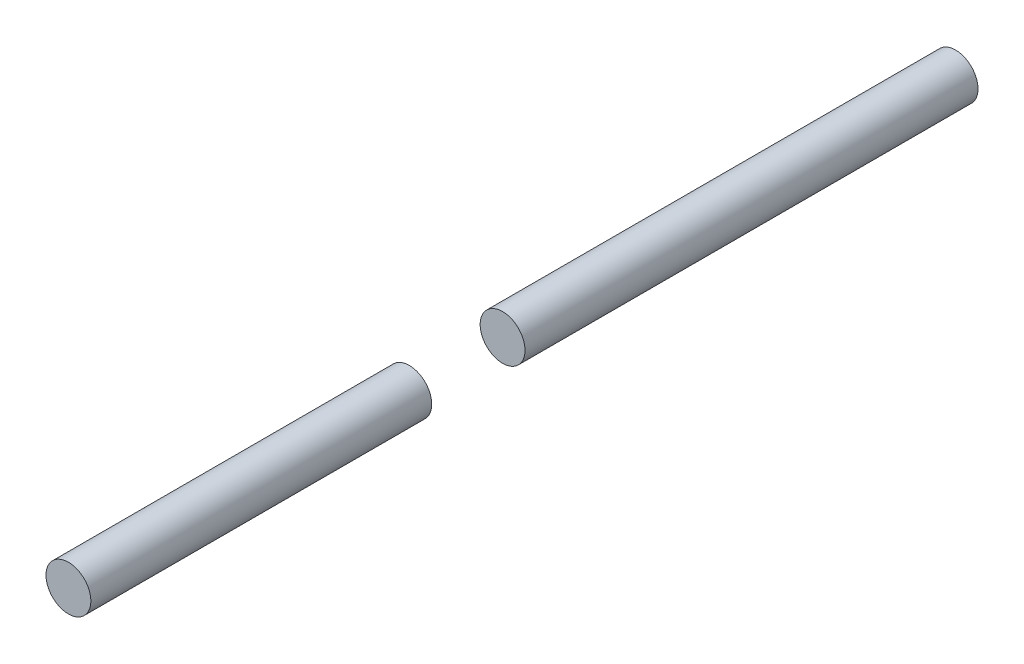
from build123d import *

# Parameters (mm, degrees)
BOSS_EXTRUDE1_OUTLINE_R = 6.35
BOSS_EXTRUDE1_DEPTH     = 96.52
SKETCH3_R               = 6.35
BOSS_EXTRUDE2_DEPTH     = 128.27


# Read off the part's stored shape, not the designer's step: Boss-Extrude1
with BuildPart() as part:
    # Boss-Extrude1 outline → Boss-Extrude1 (new body)
    with BuildSketch(Plane(origin=(0, 0, 228.346), x_dir=(-1, 0, 0), z_dir=(0, 0, -1))):
        Circle(BOSS_EXTRUDE1_OUTLINE_R)
    extrude(amount=BOSS_EXTRUDE1_DEPTH)


with BuildPart() as body_2:
    # Sketch3 → Boss-Extrude2 (new body)
    with BuildSketch(Plane.XY.offset(105.41)):
        Circle(SKETCH3_R)
    extrude(amount=-BOSS_EXTRUDE2_DEPTH)


solid = Compound([part.part, body_2.part])
